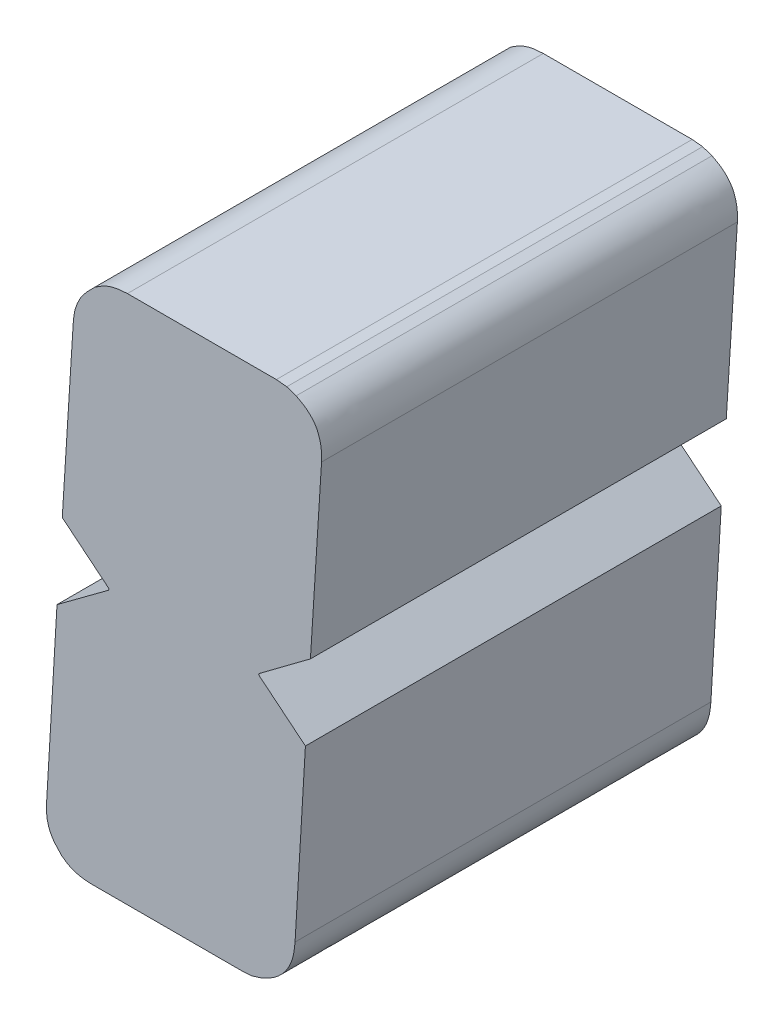
from build123d import *

# Parameters (mm, degrees)
EXTRUDE_1_DEPTH     = 3.8
CUT_EXTRUDE_START   = -3.8
CUT_EXTRUDE_1_DEPTH = 3.8


# Read off the part's stored shape, not the designer's step: Вырез-Вытянуть-Тонкостенный1
with BuildPart() as part:
    # Эскиз1 → Бобышка-Вытянуть1 (new body)
    with BuildSketch(Plane.XY):
        with BuildLine():
            Line((-1.318255437, 0.258478546), (-1.011455473, 0.007460394))
            Line((-1.011455473, 0.007460394), (-1.021853397, 0))
            Line((-1.021853397, 0), (-1.013303446, -0.006755517))
            Line((-1.013303446, -0.006755517), (-1.354182957, -0.259476533))
            Line((-1.354182957, -0.259476533), (-1.45497961, -1.965035745))
            add(Edge.make_bspline(
                [(-1.45497961, -1.965035745), (-1.45640581, -2.003703184), (-1.459192354, -2.079252548), (-1.439195647, -2.189444213), (-1.401920385, -2.293069865), (-1.360887275, -2.352996026), (-1.340211143, -2.383192158)],
                knots=[0, 0, 0, 0, 0.261167497, 0.510275296, 0.753233117, 1, 1, 1, 1], degree=3))
            Line((-1.340211143, -2.383192158), (-1.252388317, -2.478998878))
            add(Edge.make_bspline(
                [(-1.252388317, -2.478998878), (-1.223826424, -2.500445794), (-1.166852504, -2.543227091), (-1.067916042, -2.587045412), (-0.960717691, -2.613654188), (-0.886287022, -2.617003366), (-0.848203717, -2.618717012)],
                knots=[0, 0, 0, 0, 0.244974936, 0.488664468, 0.738369311, 1, 1, 1, 1], degree=3))
            Line((-0.848203717, -2.618717012), (0.525025935, -2.618717012))
            Line((0.525025935, -2.618717012), (0.652768229, -2.611731105))
            Line((0.652768229, -2.611731105), (0.781508508, -2.571811638))
            add(Edge.make_bspline(
                [(0.781508508, -2.571811638), (0.81386736, -2.556985687), (0.876622239, -2.528233099), (0.961545196, -2.472745684), (1.034068666, -2.408414236), (1.094840874, -2.335847946), (1.143241075, -2.25453384), (1.180521537, -2.165328685), (1.204445871, -2.066917619), (1.211164024, -1.998424391), (1.214634721, -1.963039772)],
                knots=[0, 0, 0, 0, 0.134662333, 0.261156306, 0.382520903, 0.500597599, 0.618135375, 0.739565345, 0.865455585, 1, 1, 1, 1], degree=3))
            Line((1.214634721, -1.963039772), (1.315431375, -0.258478546))
            Line((1.315431375, -0.258478546), (1.008642316, -0.007469317))
            Line((1.008642316, -0.007469317), (1.019029335, 0))
            Line((1.019029335, 0), (1.011344624, 0.00607187))
            Line((1.011344624, 0.00607187), (1.349362921, 0.258478546))
            Line((1.349362921, 0.258478546), (1.457145481, 1.964037759))
            add(Edge.make_bspline(
                [(1.457145481, 1.964037759), (1.457845677, 1.998685903), (1.459192354, 2.065324146), (1.444437242, 2.161701489), (1.419031977, 2.250026835), (1.380625008, 2.33058564), (1.328848362, 2.402161133), (1.265007239, 2.465541592), (1.189193466, 2.521537566), (1.13164527, 2.550062936), (1.101862228, 2.564825732)],
                knots=[0, 0, 0, 0, 0.13890651, 0.267156752, 0.389710114, 0.50679238, 0.623546631, 0.742540539, 0.866756453, 1, 1, 1, 1], degree=3))
            Line((1.101862228, 2.564825732), (0.982103828, 2.605743185))
            Line((0.982103828, 2.605743185), (0.854361535, 2.618717012))
            Line((0.854361535, 2.618717012), (-0.520864091, 2.618717012))
            add(Edge.make_bspline(
                [(-0.520864091, 2.618717012), (-0.559305217, 2.617118453), (-0.635572979, 2.613946891), (-0.746172278, 2.584611695), (-0.851357794, 2.538485458), (-0.914071086, 2.494441407), (-0.94600641, 2.472012972)],
                knots=[0, 0, 0, 0, 0.25146882, 0.498917843, 0.744835256, 1, 1, 1, 1], degree=3))
            Line((-0.94600641, 2.472012972), (-1.039817157, 2.376206252))
            add(Edge.make_bspline(
                [(-1.039817157, 2.376206252), (-1.064380545, 2.346448217), (-1.112795808, 2.28779413), (-1.162709181, 2.185792002), (-1.198785119, 2.078732957), (-1.206544744, 2.003910758), (-1.210472877, 1.966033732)],
                knots=[0, 0, 0, 0, 0.25502293, 0.502658773, 0.748232386, 1, 1, 1, 1], degree=3))
            Line((-1.210472877, 1.966033732), (-1.318255437, 0.258478546))
        make_face()
    extrude(amount=EXTRUDE_1_DEPTH)

    # Вырез-Вытянуть-Тонкостенный1 outline → Вырез-Вытянуть-Тонкостенный1 (cut)
    with BuildSketch(Plane.XY.offset(3.8).offset(CUT_EXTRUDE_START)):
        with BuildLine():
            Line((-1.354182957, -0.259476533), (-1.45497961, -1.965035745))
            add(Edge.make_bspline(
                [(-1.45497961, -1.965035745), (-1.45640581, -2.003703184), (-1.459192354, -2.079252548), (-1.439195647, -2.189444213), (-1.401920385, -2.293069865), (-1.360887275, -2.352996026), (-1.340211143, -2.383192158)],
                knots=[0, 0, 0, 0, 0.261167497, 0.510275296, 0.753233117, 1, 1, 1, 1], degree=3))
            Line((-1.340211143, -2.383192158), (-1.252388317, -2.478998878))
            add(Edge.make_bspline(
                [(-1.252388317, -2.478998878), (-1.223826424, -2.500445794), (-1.166852504, -2.543227091), (-1.067916042, -2.587045412), (-0.960717691, -2.613654188), (-0.886287022, -2.617003366), (-0.848203717, -2.618717012)],
                knots=[0, 0, 0, 0, 0.244974936, 0.488664468, 0.738369311, 1, 1, 1, 1], degree=3))
            Line((-0.848203717, -2.618717012), (0.525025935, -2.618717012))
            Line((0.525025935, -2.618717012), (0.652768229, -2.611731105))
            Line((0.652768229, -2.611731105), (0.781508508, -2.571811638))
            add(Edge.make_bspline(
                [(0.781508508, -2.571811638), (0.81386736, -2.556985687), (0.876622239, -2.528233099), (0.961545196, -2.472745684), (1.034068666, -2.408414236), (1.094840874, -2.335847946), (1.143241075, -2.25453384), (1.180521537, -2.165328685), (1.204445871, -2.066917619), (1.211164024, -1.998424391), (1.214634721, -1.963039772)],
                knots=[0, 0, 0, 0, 0.134662333, 0.261156306, 0.382520903, 0.500597599, 0.618135375, 0.739565345, 0.865455585, 1, 1, 1, 1], degree=3))
            Line((1.214634721, -1.963039772), (1.315431375, -0.258478546))
            Line((1.315431375, -0.258478546), (1.008642316, -0.007469317))
            Line((1.008642316, -0.007469317), (1.019029335, 0))
            Line((1.019029335, 0), (1.011344624, 0.00607187))
            Line((1.011344624, 0.00607187), (1.349362921, 0.258478546))
            Line((1.349362921, 0.258478546), (1.457145481, 1.964037759))
            add(Edge.make_bspline(
                [(1.457145481, 1.964037759), (1.457845677, 1.998685903), (1.459192354, 2.065324146), (1.444437242, 2.161701489), (1.419031977, 2.250026835), (1.380625008, 2.33058564), (1.328848362, 2.402161133), (1.265007239, 2.465541592), (1.189193466, 2.521537566), (1.13164527, 2.550062936), (1.101862228, 2.564825732)],
                knots=[0, 0, 0, 0, 0.13890651, 0.267156752, 0.389710114, 0.50679238, 0.623546631, 0.742540539, 0.866756453, 1, 1, 1, 1], degree=3))
            Line((1.101862228, 2.564825732), (0.982103828, 2.605743185))
            Line((0.982103828, 2.605743185), (0.854361535, 2.618717012))
            Line((0.854361535, 2.618717012), (-0.520864091, 2.618717012))
            add(Edge.make_bspline(
                [(-0.520864091, 2.618717012), (-0.559305217, 2.617118453), (-0.635572979, 2.613946891), (-0.746172278, 2.584611695), (-0.851357794, 2.538485458), (-0.914071086, 2.494441407), (-0.94600641, 2.472012972)],
                knots=[0, 0, 0, 0, 0.25146882, 0.498917843, 0.744835256, 1, 1, 1, 1], degree=3))
            Line((-0.94600641, 2.472012972), (-1.039817157, 2.376206252))
            add(Edge.make_bspline(
                [(-1.039817157, 2.376206252), (-1.064380545, 2.346448217), (-1.112795808, 2.28779413), (-1.162709181, 2.185792002), (-1.198785119, 2.078732957), (-1.206544744, 2.003910758), (-1.210472877, 1.966033732)],
                knots=[0, 0, 0, 0, 0.25502293, 0.502658773, 0.748232386, 1, 1, 1, 1], degree=3))
            Line((-1.210472877, 1.966033732), (-1.318255437, 0.258478546))
            Line((-1.318255437, 0.258478546), (-1.011455473, 0.007460394))
            Line((-1.011455473, 0.007460394), (-1.021853397, 0))
            Line((-1.021853397, 0), (-1.013303446, -0.006755517))
            Line((-1.013303446, -0.006755517), (-1.354182957, -0.259476533))
        make_face()
        with BuildLine():
            add(Edge.make_bspline(
                [(-0.890962738, 2.242360272), (-0.908040345, 2.22164355), (-0.925227906, 2.200997417), (-0.954461408, 2.156404341), (-0.966010446, 2.132055229), (-0.986425308, 2.081995312), (-0.995138703, 2.056401241), (-1.005717533, 2.003259432), (-1.008329368, 1.976320811), (-1.011124321, 1.949407339)],
                knots=[0, 0, 0, 0, 0.25, 0.25, 0.5, 0.5, 0.75, 0.75, 1, 1, 1, 1], degree=3))
            Line((-0.890962738, 2.242360272), (-0.816049696, 2.318867208))
            add(Edge.make_bspline(
                [(-0.516702669, 2.418717012), (-0.570312193, 2.416479981), (-0.623850037, 2.411902324), (-0.726132173, 2.377137017), (-0.771962058, 2.349658076), (-0.816049696, 2.318867208)],
                knots=[0, 0, 0, 0, 0.5, 0.5, 1, 1, 1, 1], degree=3))
            Line((-0.516702669, 2.418717012), (0.844231341, 2.418717012))
            Line((0.844231341, 2.418717012), (0.939111557, 2.40908074))
            Line((0.939111557, 2.40908074), (1.024738311, 2.379824932))
            add(Edge.make_bspline(
                [(1.257272687, 1.97236386), (1.258113876, 2.01430851), (1.258417785, 2.056183749), (1.244201982, 2.13801917), (1.232253283, 2.179429486), (1.19270388, 2.253176423), (1.164342715, 2.285697526), (1.100274837, 2.340200553), (1.062767239, 2.360897114), (1.024738311, 2.379824932)],
                knots=[0, 0, 0, 0, 0.25, 0.25, 0.5, 0.5, 0.75, 0.75, 1, 1, 1, 1], degree=3))
            Line((1.257272687, 1.97236386), (1.155594081, 0.363394067))
            Line((1.155594081, 0.363394067), (0.683073322, 0.010551055))
            Line((0.683073322, 0.010551055), (0.686913475, 0.00751686))
            Line((0.686913475, 0.00751686), (0.680300718, 0.00276162))
            Line((0.680300718, 0.00276162), (1.10975234, -0.348607889))
            Line((1.10975234, -0.348607889), (1.015212194, -1.947366014))
            add(Edge.make_bspline(
                [(0.709904759, -2.384620171), (0.75282168, -2.364896626), (0.795043999, -2.344136949), (0.870185675, -2.288740437), (0.904729386, -2.254562712), (0.958681636, -2.177034249), (0.979317247, -2.133222239), (1.00562776, -2.042372937), (1.01055567, -1.994793275), (1.015212194, -1.947366014)],
                knots=[0, 0, 0, 0, 0.25, 0.25, 0.5, 0.5, 0.75, 0.75, 1, 1, 1, 1], degree=3))
            Line((0.709904759, -2.384620171), (0.617154733, -2.413379869))
            Line((0.617154733, -2.413379869), (0.519561268, -2.418717012))
            Line((0.519561268, -2.418717012), (-0.843701007, -2.418717012))
            add(Edge.make_bspline(
                [(-1.117559098, -2.330106742), (-1.09785274, -2.344792791), (-1.078103779, -2.359401604), (-1.035410075, -2.382825575), (-1.012463689, -2.391955237), (-0.941603834, -2.413573455), (-0.892704311, -2.416504219), (-0.843701007, -2.418717012)],
                knots=[0, 0, 0, 0, 0.25, 0.25, 0.5, 0.5, 1, 1, 1, 1], degree=3))
            Line((-1.117559098, -2.330106742), (-1.183149998, -2.258553033))
            add(Edge.make_bspline(
                [(-1.255197127, -1.974621043), (-1.257032309, -2.024431579), (-1.257983846, -2.074423596), (-1.240751527, -2.14778759), (-1.233280402, -2.171827335), (-1.211527999, -2.217181786), (-1.197272925, -2.237827687), (-1.183149998, -2.258553033)],
                knots=[0, 0, 0, 0, 0.5, 0.5, 0.75, 0.75, 1, 1, 1, 1], degree=3))
            Line((-1.255197127, -1.974621043), (-1.160041559, -0.364513455))
            Line((-1.160041559, -0.364513455), (-0.684303055, -0.011810772))
            Line((-0.684303055, -0.011810772), (-0.689507135, -0.007698907))
            Line((-0.689507135, -0.007698907), (-0.682891645, -0.002952367))
            Line((-0.682891645, -0.002952367), (-1.112188393, 0.348290427))
            Line((-1.112188393, 0.348290427), (-1.011124321, 1.949407339))
        make_face(mode=Mode.SUBTRACT)
    extrude(amount=CUT_EXTRUDE_1_DEPTH, mode=Mode.SUBTRACT)


solid = part.part
